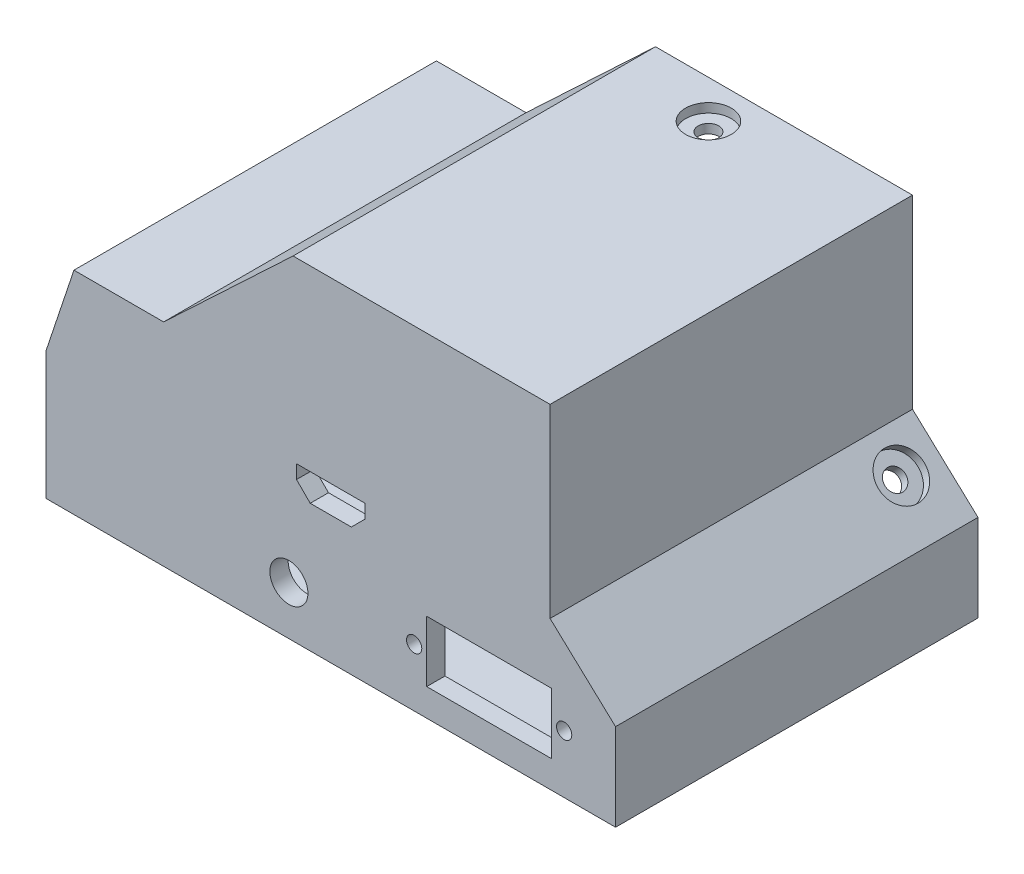
from build123d import *
from OCP.BRepFilletAPI import BRepFilletAPI_MakeChamfer

# Parameters (mm, degrees)
BOSS_EXTRUDE1_DEPTH                            = 104
SHELL1_START                                   = -8.6
SHELL1_OUTLINE_W                               = 16
SHELL1_OUTLINE_H                               = 108.8
SHELL1_DEPTH                                   = 2.4
SHELL1_START_2                                 = -56.951785259
SHELL1_2_OUTLINE_W                             = 43.8
SHELL1_2_OUTLINE_H                             = 108.8
SHELL1_2_DEPTH                                 = 50.751785259
SHELL1_START_3                                 = -72.4
SHELL1_3_OUTLINE_W                             = 27.8
SHELL1_3_OUTLINE_H                             = 108.8
SHELL1_3_DEPTH                                 = 74.8
SHELL1_4_DEPTH                                 = 104
SHELL1_START_4                                 = -2.4
SHELL1_5_DEPTH                                 = 108.8
SPLIT1_SURFACE_1_BACK                          = 140.108
SPLIT1_SURFACE_1_DEPTH                         = 280.216
SPLIT1_SURFACE_2_BACK                          = 140.108
SPLIT1_SURFACE_2_DEPTH                         = 280.216
BOSS_EXTRUDE2_DEPTH                            = 4
BOSS_EXTRUDE3_DEPTH                            = 4
BOSS_EXTRUDE4_DEPTH                            = 4
CHAMFER1_SIZE                                  = 4
CHAMFER1_SIZE_2                                = 6.92820323
CBORE_START                                    = 7.057493905
CBORE_FOR_M2_5_PAN_HEAD_MACHINE_SCREW1_O_R     = 3
CBORE_FOR_M2_5_PAN_HEAD_MACHINE_SCREW1_DEPTH   = 1.2
CBORE_START_2                                  = 5.857493905
CBORE_FOR_M2_5_PAN_HEAD_MACHINE_SCRE_2_R       = 1.35
CBORE_FOR_M2_5_PAN_HEAD_MACHINE_SCREW1_2_DEPTH = 1.2
CBORE_START_3                                  = 40.2
CBORE_FOR_M2_5_PAN_HEAD_MACHINE_SCRE_3_R       = 3
CBORE_FOR_M2_5_PAN_HEAD_MACHINE_SCREW1_3_DEPTH = 1.2
CBORE_START_4                                  = 38
CBORE_FOR_M2_5_PAN_HEAD_MACHINE_SCRE_4_R       = 1.35
CBORE_FOR_M2_5_PAN_HEAD_MACHINE_SCREW1_4_DEPTH = 2.2
CBORE_START_5                                  = -72.4
CBORE_FOR_M2_5_PAN_HEAD_MACHINE_SCRE_5_R       = 3
CBORE_FOR_M2_5_PAN_HEAD_MACHINE_SCREW1_5_DEPTH = 1.2
CBORE_START_6                                  = -71.2
CBORE_FOR_M2_5_PAN_HEAD_MACHINE_SCRE_6_R       = 1.35
CBORE_FOR_M2_5_PAN_HEAD_MACHINE_SCREW1_6_DEPTH = 1.2
CUT_EXTRUDE2_REACH                             = 96.862
SKETCH12_R                                     = 1
SKETCH12_R_2                                   = 2.5
SKETCH12_W                                     = 16.4
SKETCH12_H                                     = 8


with BuildPart() as part:
    # Sketch1 → Boss-Extrude1 (new body)
    with BuildSketch(Plane.XY):
        Polygon((-39, 39), (-56, 23), (-67, 23), (-70, 14.000026796), (-70, 0), (0, 0), (0, 8), (-8.6, 16), (-8.6, 39), align=None)
    extrude(amount=BOSS_EXTRUDE1_DEPTH)

    # Shell1: read off the stored shape, not the designer's step
    # Shell1 outline → Shell1 (add)
    with BuildSketch(Plane.YZ.offset(SHELL1_START)):
        with Locations((33.4, 52)):
            Rectangle(SHELL1_OUTLINE_W, SHELL1_OUTLINE_H)
    extrude(amount=SHELL1_DEPTH)

    # Shell1 2 outline → Shell1 2 (add)
    with BuildSketch(Plane.YZ.offset(SHELL1_START_2)):
        with Locations((19.5, 52)):
            Rectangle(SHELL1_2_OUTLINE_W, SHELL1_2_OUTLINE_H)
    extrude(amount=SHELL1_2_DEPTH)

    # Shell1 3 outline → Shell1 3 (add)
    with BuildSketch(Plane.YZ.offset(SHELL1_START_3)):
        with Locations((11.5, 52)):
            Rectangle(SHELL1_3_OUTLINE_W, SHELL1_3_OUTLINE_H)
    extrude(amount=SHELL1_3_DEPTH)

    # Shell1 4 outline → Shell1 4 (cut)
    with BuildSketch(Plane.XY):
        Polygon((-6.2, 25.4), (-6.2, 17.045294183), (2.4, 9.045294183), (2.4, 25.4), align=None)
        Polygon((-72.4, 14.389494281), (-68.729820499, 25.4), (-72.4, 25.4), align=None)
        Polygon((-56.951785259, 25.4), (-39.951785259, 41.4), (-56.951785259, 41.4), align=None)
        Polygon((0, 0), (0, 8), (-8.6, 16), (-8.6, 39), (-39, 39), (-56, 23), (-67, 23), (-70, 14.000026796), (-70, 0), align=None)
    extrude(amount=SHELL1_4_DEPTH, mode=Mode.SUBTRACT)

    # Shell1 5 outline → Shell1 5 (cut)
    with BuildSketch(Plane.XY.offset(SHELL1_START_4)):
        Polygon((-6.2, 25.4), (-6.2, 17.045294183), (2.4, 9.045294183), (2.4, 25.4), align=None)
        Polygon((-72.4, 14.389494281), (-68.729820499, 25.4), (-72.4, 25.4), align=None)
        Polygon((-56.951785259, 25.4), (-39.951785259, 41.4), (-56.951785259, 41.4), align=None)
    extrude(amount=SHELL1_5_DEPTH, mode=Mode.SUBTRACT)


with BuildPart() as body_2:
    # Split1: the piece behind the surface
    add(part.part)
    # Split1 surface: a surface, the sketch's curves swept straight by 280.216 mm
    with BuildLine(Plane(origin=(0, 0, 0), x_dir=(0, 0, -1), z_dir=(1, 0, 0)).offset(-SPLIT1_SURFACE_1_BACK), mode=Mode.PRIVATE) as split1_surface_1_path:
        Line((-58.8, -2.4), (-58.8, 41.4))
    split1_surface_1 = Shell.extrude(split1_surface_1_path.wire(), (1 * SPLIT1_SURFACE_1_DEPTH, 0 * SPLIT1_SURFACE_1_DEPTH, 0 * SPLIT1_SURFACE_1_DEPTH))
    split(bisect_by=split1_surface_1, keep=Keep.BOTTOM)

    # Sketch3 → Boss-Extrude2 (add)
    with BuildSketch(Plane(origin=(3.989562192, 4.288779356, 0), x_dir=(0.7321867381630838, -0.6811039424772873, 0), z_dir=(-0.6811039424772873, -0.7321867381630838, 0))):
        with BuildLine():
            Line((-14.321650284, 51.3), (-8.321650284, 51.3))
            Line((-8.321650284, 51.3), (-8.321650284, 63.8))
            ThreePointArc((-8.321650284, 63.8), (-11.321650284, 66.8), (-14.321650284, 63.8))
            Line((-14.321650284, 63.8), (-14.321650284, 51.3))
        make_face()
    extrude(amount=BOSS_EXTRUDE2_DEPTH)

    # Sketch4 → Boss-Extrude3 (add)
    with BuildSketch(Plane.XZ.offset(-39)):
        with BuildLine():
            Line((-31, 51.3), (-25, 51.3))
            Line((-25, 51.3), (-25, 63.8))
            ThreePointArc((-25, 63.8), (-28, 66.8), (-31, 63.8))
            Line((-31, 63.8), (-31, 51.3))
        make_face()
    extrude(amount=BOSS_EXTRUDE3_DEPTH)

    # Sketch5 → Boss-Extrude4 (add)
    with BuildSketch(Plane(origin=(-70, 0, 0), x_dir=(0, 0, -1), z_dir=(1, 0, 0))):
        with BuildLine():
            Line((-51.3, 10.000013398), (-63.8, 10.000013398))
            ThreePointArc((-63.8, 10.000013398), (-66.8, 7.000013398), (-63.8, 4.000013398))
            Line((-63.8, 4.000013398), (-51.3, 4.000013398))
            Line((-51.3, 4.000013398), (-51.3, 10.000013398))
        make_face()
    extrude(amount=BOSS_EXTRUDE4_DEPTH)

    # Chamfer1
    chamfer1_edges_1 = [body_2.edges().sort_by_distance(p)[0] for p in [
        (-7.02441577, 9.071253047, 51.3),
    ]]
    chamfer1_side_1 = [body_2.faces().sort_by_distance(p)[0] for p in [
        (-6.969927455, 9.129827986, 51.3),
    ]]
    chamfer1_edges_2 = [body_2.edges().sort_by_distance(p)[0] for p in [
        (-28, 35, 51.3),
    ]]
    chamfer1_side_2 = [body_2.faces().sort_by_distance(p)[0] for p in [
        (-28, 35.08, 51.3),
    ]]
    chamfer1_edges_3 = [body_2.edges().sort_by_distance(p)[0] for p in [
        (-66, 7.000013398, 51.3),
    ]]
    chamfer1_side_3 = [body_2.faces().sort_by_distance(p)[0] for p in [
        (-66.08, 7.000013398, 51.3),
    ]]
    chamfer1 = BRepFilletAPI_MakeChamfer(body_2.part.solid().wrapped)
    for e in chamfer1_edges_1:
        chamfer1.Add(CHAMFER1_SIZE - 0.0001, CHAMFER1_SIZE_2 - 0.0001, e.wrapped, chamfer1_side_1[0].wrapped)
    for e in chamfer1_edges_2:
        chamfer1.Add(CHAMFER1_SIZE - 0.0001, CHAMFER1_SIZE_2 - 0.0001, e.wrapped, chamfer1_side_2[0].wrapped)
    for e in chamfer1_edges_3:
        chamfer1.Add(CHAMFER1_SIZE - 0.0001, CHAMFER1_SIZE_2 - 0.0001, e.wrapped, chamfer1_side_3[0].wrapped)
    add(Compound.cast(chamfer1.Shape()), mode=Mode.REPLACE)  # a hair under: the kernel refuses the full size

    # CBORE for M2.5 Pan Head Machine Screw1 7: loft between two sections, ruled curve by curve
    cbore_for_m2_5_pan_head_machine_screw1_7_from = [
        Edge.make_three_point_arc((-8.012867866, 9.99074337, 63.8), (-7.02441577, 9.071253047, 65.15), (-6.035963673, 8.151762725, 63.8)),
        Edge.make_three_point_arc((-6.035963673, 8.151762725, 63.8), (-7.02441577, 9.071253047, 62.45), (-8.012867866, 9.99074337, 63.8)),
    ]
    cbore_for_m2_5_pan_head_machine_screw1_7_to = [
        Edge.make_three_point_arc((-5.288452097, 12.919490322, 63.8), (-4.3, 12, 65.15), (-3.311547903, 11.080509678, 63.8)),
        Edge.make_three_point_arc((-3.311547903, 11.080509678, 63.8), (-4.3, 12, 62.45), (-5.288452097, 12.919490322, 63.8)),
    ]
    cbore_for_m2_5_pan_head_machine_screw1_7 = Solid(Shell([*[Face.make_surface_from_curves(cbore_for_m2_5_pan_head_machine_screw1_7_from[k], cbore_for_m2_5_pan_head_machine_screw1_7_to[k]) for k in range(2)], Face(Wire(cbore_for_m2_5_pan_head_machine_screw1_7_from)), Face(Wire(cbore_for_m2_5_pan_head_machine_screw1_7_to))]))
    add(cbore_for_m2_5_pan_head_machine_screw1_7, mode=Mode.SUBTRACT)

    # CBORE for M2.5 Pan Head Machine Screw1 8: loft between two sections, ruled curve by curve
    cbore_for_m2_5_pan_head_machine_screw1_8_from = [
        Edge.make_three_point_arc((-29.35, 35, 63.8), (-28, 35, 65.15), (-26.65, 35, 63.8)),
        Edge.make_three_point_arc((-26.65, 35, 63.8), (-28, 35, 62.45), (-29.35, 35, 63.8)),
    ]
    cbore_for_m2_5_pan_head_machine_screw1_8_to = [
        Edge.make_three_point_arc((-29.35, 39, 63.8), (-28, 39, 65.15), (-26.65, 39, 63.8)),
        Edge.make_three_point_arc((-26.65, 39, 63.8), (-28, 39, 62.45), (-29.35, 39, 63.8)),
    ]
    cbore_for_m2_5_pan_head_machine_screw1_8 = Solid(Shell([*[Face.make_surface_from_curves(cbore_for_m2_5_pan_head_machine_screw1_8_from[k], cbore_for_m2_5_pan_head_machine_screw1_8_to[k]) for k in range(2)], Face(Wire(cbore_for_m2_5_pan_head_machine_screw1_8_from)), Face(Wire(cbore_for_m2_5_pan_head_machine_screw1_8_to))]))
    add(cbore_for_m2_5_pan_head_machine_screw1_8, mode=Mode.SUBTRACT)

    # CBORE for M2.5 Pan Head Machine Screw1 9: loft between two sections, ruled curve by curve
    cbore_for_m2_5_pan_head_machine_screw1_9_from = [
        Edge.make_three_point_arc((-66, 7.000013398, 65.15), (-66, 8.350013398, 63.8), (-66, 7.000013398, 62.45)),
        Edge.make_three_point_arc((-66, 7.000013398, 62.45), (-66, 5.650013398, 63.8), (-66, 7.000013398, 65.15)),
    ]
    cbore_for_m2_5_pan_head_machine_screw1_9_to = [
        Edge.make_three_point_arc((-70, 7.000013398, 65.15), (-70, 8.350013398, 63.8), (-70, 7.000013398, 62.45)),
        Edge.make_three_point_arc((-70, 7.000013398, 62.45), (-70, 5.650013398, 63.8), (-70, 7.000013398, 65.15)),
    ]
    cbore_for_m2_5_pan_head_machine_screw1_9 = Solid(Shell([*[Face.make_surface_from_curves(cbore_for_m2_5_pan_head_machine_screw1_9_from[k], cbore_for_m2_5_pan_head_machine_screw1_9_to[k]) for k in range(2)], Face(Wire(cbore_for_m2_5_pan_head_machine_screw1_9_from)), Face(Wire(cbore_for_m2_5_pan_head_machine_screw1_9_to))]))
    add(cbore_for_m2_5_pan_head_machine_screw1_9, mode=Mode.SUBTRACT)


with BuildPart() as part_1:
    add(part.part)

    # Split1: split by a surface, the side it looks to stays
    # Split1 surface: a surface, the sketch's curves swept straight by 280.216 mm
    with BuildLine(Plane(origin=(0, 0, 0), x_dir=(0, 0, -1), z_dir=(1, 0, 0)).offset(-SPLIT1_SURFACE_2_BACK), mode=Mode.PRIVATE) as split1_surface_2_path:
        Line((-58.8, -2.4), (-58.8, 41.4))
    split1_surface_2 = Shell.extrude(split1_surface_2_path.wire(), (1 * SPLIT1_SURFACE_2_DEPTH, 0 * SPLIT1_SURFACE_2_DEPTH, 0 * SPLIT1_SURFACE_2_DEPTH))
    split(bisect_by=split1_surface_2, keep=Keep.TOP)

    # CBORE for M2.5 Pan Head Machine Screw1: read off the stored shape, not the designer's step
    # CBORE for M2.5 Pan Head Machine Screw1 o → CBORE for M2.5 Pan Head Machine Screw1 (cut)
    with BuildSketch(Plane(origin=(0, 0, 0), x_dir=(0.732186738163084, -0.681103942477287, 0), z_dir=(0.681103942477287, 0.732186738163084, 0)).offset(CBORE_START)):
        with Locations((-11.321650284, -63.8)):
            Circle(CBORE_FOR_M2_5_PAN_HEAD_MACHINE_SCREW1_O_R)
    extrude(amount=CBORE_FOR_M2_5_PAN_HEAD_MACHINE_SCREW1_DEPTH, mode=Mode.SUBTRACT)

    # CBORE for M2.5 Pan Head Machine Scre 2 → CBORE for M2.5 Pan Head Machine Screw1 2 (cut)
    with BuildSketch(Plane(origin=(0, 0, 0), x_dir=(0.732186738163084, -0.681103942477287, 0), z_dir=(0.681103942477287, 0.732186738163084, 0)).offset(CBORE_START_2)):
        with Locations((-11.321650284, -63.8)):
            Circle(CBORE_FOR_M2_5_PAN_HEAD_MACHINE_SCRE_2_R)
    extrude(amount=CBORE_FOR_M2_5_PAN_HEAD_MACHINE_SCREW1_2_DEPTH, mode=Mode.SUBTRACT)

    # CBORE for M2.5 Pan Head Machine Scre 3 → CBORE for M2.5 Pan Head Machine Screw1 3 (cut)
    with BuildSketch(Plane(origin=(0, 0, 0), x_dir=(1, 0, 0), z_dir=(0, 1, 0)).offset(CBORE_START_3)):
        with Locations((-28, -63.8)):
            Circle(CBORE_FOR_M2_5_PAN_HEAD_MACHINE_SCRE_3_R)
    extrude(amount=CBORE_FOR_M2_5_PAN_HEAD_MACHINE_SCREW1_3_DEPTH, mode=Mode.SUBTRACT)

    # CBORE for M2.5 Pan Head Machine Scre 4 → CBORE for M2.5 Pan Head Machine Screw1 4 (cut)
    with BuildSketch(Plane(origin=(0, 0, 0), x_dir=(1, 0, 0), z_dir=(0, 1, 0)).offset(CBORE_START_4)):
        with Locations((-28, -63.8)):
            Circle(CBORE_FOR_M2_5_PAN_HEAD_MACHINE_SCRE_4_R)
    extrude(amount=CBORE_FOR_M2_5_PAN_HEAD_MACHINE_SCREW1_4_DEPTH, mode=Mode.SUBTRACT)

    # CBORE for M2.5 Pan Head Machine Scre 5 → CBORE for M2.5 Pan Head Machine Screw1 5 (cut)
    with BuildSketch(Plane.YZ.offset(CBORE_START_5)):
        with Locations((7.000013398, 63.8)):
            Circle(CBORE_FOR_M2_5_PAN_HEAD_MACHINE_SCRE_5_R)
    extrude(amount=CBORE_FOR_M2_5_PAN_HEAD_MACHINE_SCREW1_5_DEPTH, mode=Mode.SUBTRACT)

    # CBORE for M2.5 Pan Head Machine Scre 6 → CBORE for M2.5 Pan Head Machine Screw1 6 (cut)
    with BuildSketch(Plane.YZ.offset(CBORE_START_6)):
        with Locations((7.000013398, 63.8)):
            Circle(CBORE_FOR_M2_5_PAN_HEAD_MACHINE_SCRE_6_R)
    extrude(amount=CBORE_FOR_M2_5_PAN_HEAD_MACHINE_SCREW1_6_DEPTH, mode=Mode.SUBTRACT)

    # Sketch12 → Cut-Extrude2 (cut, up to next)
    with BuildSketch(Plane(origin=(0, 0, 104), x_dir=(-1, 0, 0), z_dir=(0, 0, -1)), mode=Mode.PRIVATE) as cut_extrude2_sk1:
        with Locations((4.35, 5.2)):
            Circle(SKETCH12_R)
    cut_extrude2_tool1 = extrude(cut_extrude2_sk1.sketch, amount=-CUT_EXTRUDE2_REACH, mode=Mode.PRIVATE) & part_1.part
    # Sketch12 → Cut-Extrude2 (cut, up to next)
    with BuildSketch(Plane(origin=(0, 0, 104), x_dir=(-1, 0, 0), z_dir=(0, 0, -1)), mode=Mode.PRIVATE) as cut_extrude2_sk2:
        with Locations((24.05, 5.2)):
            Circle(SKETCH12_R)
    cut_extrude2_tool2 = extrude(cut_extrude2_sk2.sketch, amount=-CUT_EXTRUDE2_REACH, mode=Mode.PRIVATE) & part_1.part
    # Sketch12 → Cut-Extrude2 (cut, up to next)
    with BuildSketch(Plane(origin=(0, 0, 104), x_dir=(-1, 0, 0), z_dir=(0, 0, -1)), mode=Mode.PRIVATE) as cut_extrude2_sk3:
        with Locations((40.5, 4)):
            Circle(SKETCH12_R_2)
    cut_extrude2_tool3 = extrude(cut_extrude2_sk3.sketch, amount=-CUT_EXTRUDE2_REACH, mode=Mode.PRIVATE) & part_1.part
    # Sketch12 → Cut-Extrude2 (cut, up to next)
    with BuildSketch(Plane(origin=(0, 0, 104), x_dir=(-1, 0, 0), z_dir=(0, 0, -1)), mode=Mode.PRIVATE) as cut_extrude2_sk4:
        with Locations((14.2, 5.2)):
            Rectangle(SKETCH12_W, SKETCH12_H)
    cut_extrude2_tool4 = extrude(cut_extrude2_sk4.sketch, amount=-CUT_EXTRUDE2_REACH, mode=Mode.PRIVATE) & part_1.part
    # Sketch12 → Cut-Extrude2 (cut, up to next)
    with BuildSketch(Plane(origin=(0, 0, 104), x_dir=(-1, 0, 0), z_dir=(0, 0, -1)), mode=Mode.PRIVATE) as cut_extrude2_sk5:
        Polygon((30.5, 16.2), (32.3, 14.4), (37.7, 14.4), (39.5, 16.2), (39.5, 18), (30.5, 18), align=None)
    cut_extrude2_tool5 = extrude(cut_extrude2_sk5.sketch, amount=-CUT_EXTRUDE2_REACH, mode=Mode.PRIVATE) & part_1.part
    add(cut_extrude2_tool1.solids().sort_by_distance((-4.35, 5.2, 104))[0], mode=Mode.SUBTRACT)
    add(cut_extrude2_tool2.solids().sort_by_distance((-24.05, 5.2, 104))[0], mode=Mode.SUBTRACT)
    add(cut_extrude2_tool3.solids().sort_by_distance((-40.5, 4, 104))[0], mode=Mode.SUBTRACT)
    add(cut_extrude2_tool4.solids().sort_by_distance((-14.2, 5.2, 104))[0], mode=Mode.SUBTRACT)
    add(cut_extrude2_tool5.solids().sort_by_distance((-35, 16.333333, 104))[0], mode=Mode.SUBTRACT)


solid = part_1.part
